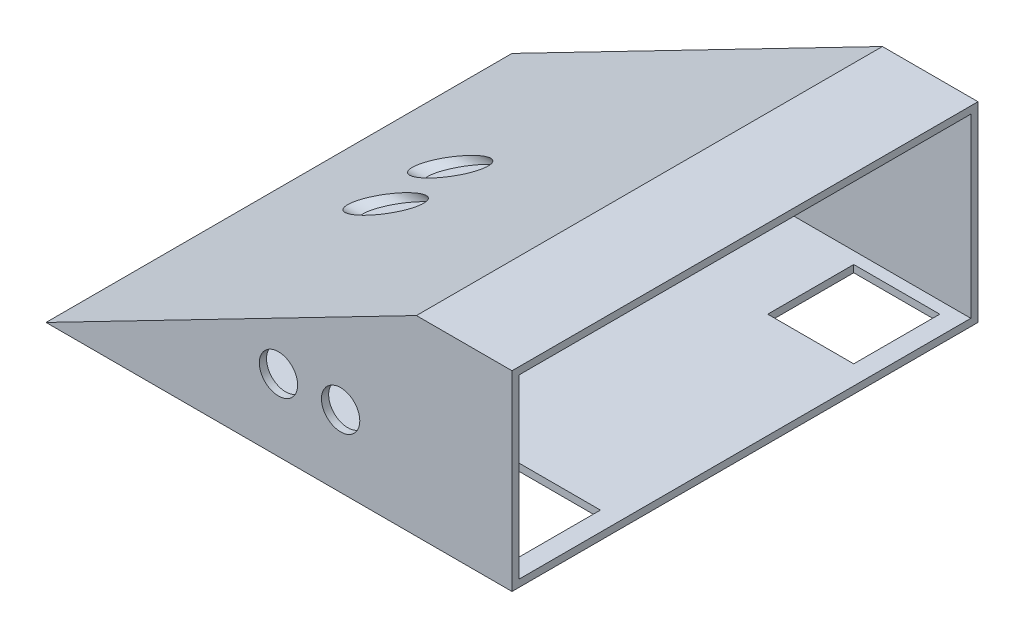
from build123d import *

# Parameters (mm, degrees)
ROBOT_DEPTH                 = 195
VACIO_POR_DENTRO_3MM_T      = -3
SKETCH3_R                   = 8.02
ULTRASONICO_DERECHA_DEPTH   = 3
SKETCH9_R                   = 8.2
ULTRASONICO_IZQUIERDA_DEPTH = 3
SKETCH10_W                  = 37
SKETCH10_H                  = 37
RUEDA_DERECHA_DEPTH         = 3
SKETCH12_W                  = 36
SKETCH12_H                  = 36
RUEDA_IZQUIERDA_DEPTH       = 3
SKETCH14_W                  = 7.1
SKETCH14_H                  = 7.1
CYN70_DERECHA_DEPTH         = 4
SKETCH15_W                  = 7.1
SKETCH15_H                  = 7.1
CNY70_CENTRO_DEPTH          = 4
SKETCH13_W                  = 7.1
SKETCH13_H                  = 7.1
CNY70_IZQUIERDA_DEPTH       = 4
ULTRASONICO_CENTRO_R        = 8.2
CUT_EXTRUDE4_DEPTH          = 75


with BuildPart() as part:
    # Sketch2 → Robot (new body)
    with BuildSketch(Plane.XY):
        Polygon((0, 0), (195, 0), (195, 80), (155, 80), align=None)
    extrude(amount=ROBOT_DEPTH)

    # Vacio por dentro 3mm
    vacio_por_dentro_3mm_openings = [part.faces().sort_by_distance(p)[0] for p in [
        (195, 40, 97.5),
    ]]
    offset(amount=VACIO_POR_DENTRO_3MM_T, openings=vacio_por_dentro_3mm_openings, kind=Kind.INTERSECTION)

    # Sketch3 → Ultrasonico Derecha (cut)
    with BuildSketch(Plane.XY.offset(195)):
        with Locations((97.289863967, 30)):
            Circle(SKETCH3_R)
        with Locations((123.289863967, 30)):
            Circle(SKETCH3_R)
    extrude(amount=-ULTRASONICO_DERECHA_DEPTH, mode=Mode.SUBTRACT)

    # Sketch9 → Ultrasonico Izquierda (cut)
    with BuildSketch(Plane(origin=(0, 0, 0), x_dir=(-1, 0, 0), z_dir=(0, 0, -1))):
        with Locations((-97.284004153, 30)):
            Circle(SKETCH9_R)
        with Locations((-123.284004153, 30)):
            Circle(SKETCH9_R)
    extrude(amount=-ULTRASONICO_IZQUIERDA_DEPTH, mode=Mode.SUBTRACT)

    # Sketch10 → Rueda Derecha (cut)
    with BuildSketch(Plane(origin=(0, 0, 0), x_dir=(-1, 0, 0), z_dir=(0, -1, 0))):
        with Locations((-168.5, -168.5)):
            Rectangle(SKETCH10_W, SKETCH10_H)
    extrude(amount=-RUEDA_DERECHA_DEPTH, mode=Mode.SUBTRACT)

    # Sketch12 → Rueda Izquierda (cut)
    with BuildSketch(Plane(origin=(0, 0, 0), x_dir=(-1, 0, 0), z_dir=(0, -1, 0))):
        with Locations((-169, -26)):
            Rectangle(SKETCH12_W, SKETCH12_H)
    extrude(amount=-RUEDA_IZQUIERDA_DEPTH, mode=Mode.SUBTRACT)

    # Sketch14 → Cyn70 Derecha (cut)
    with BuildSketch(Plane(origin=(0, 0, 0), x_dir=(-1, 0, 0), z_dir=(0, -1, 0))):
        with Locations((-18.55, -183.45)):
            Rectangle(SKETCH14_W, SKETCH14_H)
    extrude(amount=-CYN70_DERECHA_DEPTH, mode=Mode.SUBTRACT)

    # Sketch15 → Cny70 Centro (cut)
    with BuildSketch(Plane(origin=(0, 0, 0), x_dir=(-1, 0, 0), z_dir=(0, -1, 0))):
        with Locations((-18.55, -97.5)):
            Rectangle(SKETCH15_W, SKETCH15_H)
    extrude(amount=-CNY70_CENTRO_DEPTH, mode=Mode.SUBTRACT)

    # Sketch13 → Cny70 Izquierda (cut)
    with BuildSketch(Plane.XZ):
        with Locations((18.55, 11.55)):
            Rectangle(SKETCH13_W, SKETCH13_H)
    extrude(amount=-CNY70_IZQUIERDA_DEPTH, mode=Mode.SUBTRACT)

    # Ultrasonico Centro → Cut-Extrude4 (cut)
    with BuildSketch(Plane(origin=(0, 0, 0), x_dir=(0, 0, -1), z_dir=(1, 0, 0))):
        with Locations((-84, 30)):
            Circle(ULTRASONICO_CENTRO_R)
        with Locations((-111, 30)):
            Circle(ULTRASONICO_CENTRO_R)
    extrude(amount=CUT_EXTRUDE4_DEPTH, mode=Mode.SUBTRACT)


solid = part.part
